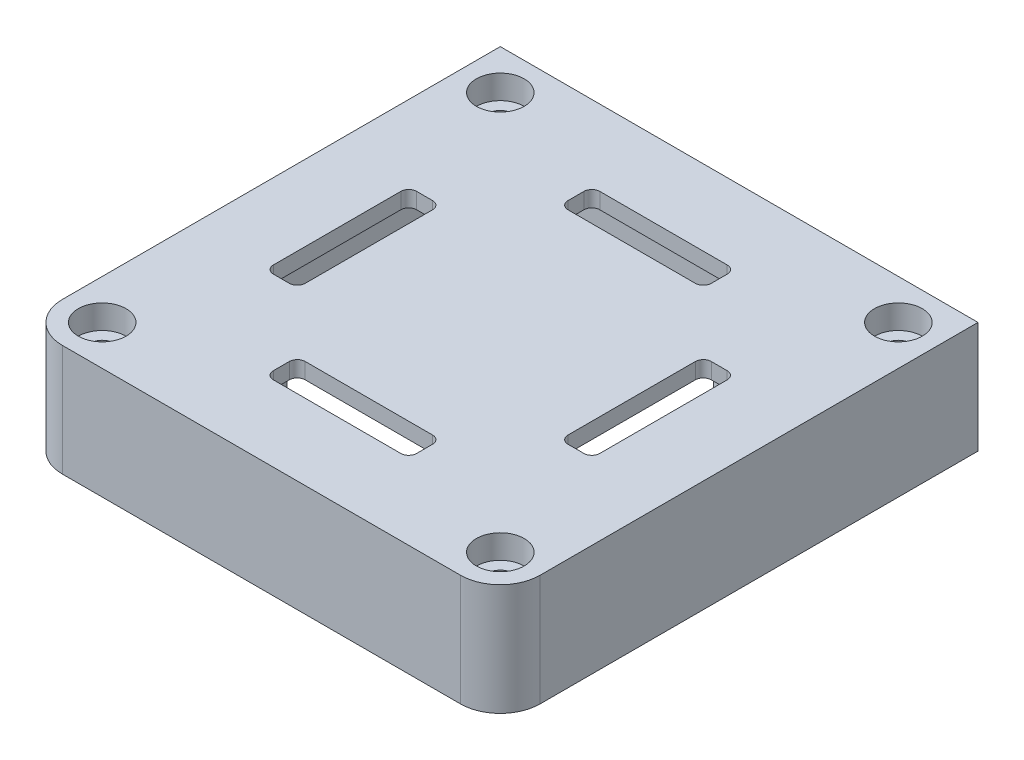
from build123d import *

# Parameters (mm, degrees)
SKETCH1_W           = 60
SKETCH1_H           = 60
BOSS_EXTRUDE1_DEPTH = 14
SKETCH2_R           = 1.5
CUT_EXTRUDE1_DEPTH  = 42
SKETCH3_R           = 3
CUT_EXTRUDE2_DEPTH  = 3
SKETCH4_W           = 45
SKETCH4_H           = 45
CUT_EXTRUDE3_DEPTH  = 12
SKETCH5_W           = 18
SKETCH5_H           = 4
SKETCH5_W_2         = 4
SKETCH5_H_2         = 18
CUT_EXTRUDE4_DEPTH  = 7
SKETCH6_R           = 2.5
BOSS_EXTRUDE2_DEPTH = 2.5
SKETCH7_R           = 1.5
CUT_EXTRUDE5_DEPTH  = 4
FILLET1_R           = 2.5
SKETCH8_R           = 3
BOSS_EXTRUDE3_DEPTH = 5
FILLET2_R           = 2.5
SKETCH9_R           = 2
CUT_EXTRUDE6_DEPTH  = 5
FILLET3_R           = 1
FILLET4_R           = 6
FILLET5_R           = 5


with BuildPart() as part:
    # Sketch1 → Boss-Extrude1 (new body)
    with BuildSketch(Plane(origin=(0, 0, 0), x_dir=(1, 0, 0), z_dir=(0, 1, 0))):
        Rectangle(SKETCH1_W, SKETCH1_H)
    extrude(amount=BOSS_EXTRUDE1_DEPTH)

    # Sketch2 → Cut-Extrude1 (cut)
    with BuildSketch(Plane(origin=(0, 14, 0), x_dir=(1, 0, 0), z_dir=(0, 1, 0))):
        with Locations(Location((-25, 25, 0), (0, 0, 270))):
            Circle(SKETCH2_R)
        with Locations(Location((-25, -25, 0), (0, 0, 270))):
            Circle(SKETCH2_R)
        with Locations(Location((25, -25, 0), (0, 0, 270))):
            Circle(SKETCH2_R)
        with Locations(Location((25, 25, 0), (0, 0, 270))):
            Circle(SKETCH2_R)
    extrude(amount=-CUT_EXTRUDE1_DEPTH, mode=Mode.SUBTRACT)

    # Sketch3 → Cut-Extrude2 (cut)
    with BuildSketch(Plane(origin=(0, 14, 0), x_dir=(1, 0, 0), z_dir=(0, 1, 0))):
        with Locations(Location((-25, 25, 0), (0, 0, 270))):
            Circle(SKETCH3_R)
        with Locations(Location((-25, -25, 0), (0, 0, 270))):
            Circle(SKETCH3_R)
        with Locations(Location((25, -25, 0), (0, 0, 270))):
            Circle(SKETCH3_R)
        with Locations(Location((25, 25, 0), (0, 0, 270))):
            Circle(SKETCH3_R)
    extrude(amount=-CUT_EXTRUDE2_DEPTH, mode=Mode.SUBTRACT)

    # Sketch4 → Cut-Extrude3 (cut)
    with BuildSketch(Plane.XZ):
        Rectangle(SKETCH4_W, SKETCH4_H)
    extrude(amount=-CUT_EXTRUDE3_DEPTH, mode=Mode.SUBTRACT)

    # Sketch5 → Cut-Extrude4 (cut)
    with BuildSketch(Plane.XZ.offset(-12)):
        with Locations((0, 18.5)):
            Rectangle(SKETCH5_W, SKETCH5_H)
        with Locations((0, -18.5)):
            Rectangle(SKETCH5_W, SKETCH5_H)
        with Locations((-18.5, 0)):
            Rectangle(SKETCH5_W_2, SKETCH5_H_2)
        with Locations((18.5, 0)):
            Rectangle(SKETCH5_W_2, SKETCH5_H_2)
    extrude(amount=-CUT_EXTRUDE4_DEPTH, mode=Mode.SUBTRACT)

    # Sketch6 → Boss-Extrude2 (add)
    with BuildSketch(Plane.XZ.offset(-12)):
        with Locations(Location((0, 6, 0), (0, 0, 270))):
            Circle(SKETCH6_R)
        with Locations(Location((0, -6, 0), (0, 0, 270))):
            Circle(SKETCH6_R)
    extrude(amount=BOSS_EXTRUDE2_DEPTH)

    # Sketch7 → Cut-Extrude5 (cut)
    with BuildSketch(Plane.XZ.offset(-9.5)):
        with Locations(Location((0, 6, 0), (0, 0, 270))):
            Circle(SKETCH7_R)
        with Locations(Location((0, -6, 0), (0, 0, 270))):
            Circle(SKETCH7_R)
    extrude(amount=-CUT_EXTRUDE5_DEPTH, mode=Mode.SUBTRACT)

    # Fillet1
    fillet1_edges = [part.edges().sort_by_distance(p)[0] for p in [
        (0, 12, 8.5),
        (0, 12, -3.5),
    ]]
    fillet(fillet1_edges, radius=FILLET1_R - 0.0001)  # a hair under: the kernel refuses the full size

    # Sketch8 → Boss-Extrude3 (add)
    with BuildSketch(Plane.XZ.offset(-12)):
        with Locations(Location((-15.5, 15.5, 0), (0, 0, 270))):
            Circle(SKETCH8_R)
        with Locations(Location((15.5, 15.5, 0), (0, 0, 270))):
            Circle(SKETCH8_R)
        with Locations(Location((15.5, -15.5, 0), (0, 0, 270))):
            Circle(SKETCH8_R)
        with Locations(Location((-15.5, -15.5, 0), (0, 0, 270))):
            Circle(SKETCH8_R)
    extrude(amount=BOSS_EXTRUDE3_DEPTH)

    # Fillet2
    fillet2_edges = [part.edges().sort_by_distance(p)[0] for p in [
        (-15.5, 12, -12.5),
        (15.5, 12, -12.5),
        (15.5, 12, 18.5),
        (-15.5, 12, 18.5),
    ]]
    fillet(fillet2_edges, radius=FILLET2_R)

    # Sketch9 → Cut-Extrude6 (cut)
    with BuildSketch(Plane.XZ.offset(-7)):
        with Locations(Location((-15.5, 15.5, 0), (0, 0, 270))):
            Circle(SKETCH9_R)
        with Locations(Location((-15.5, -15.5, 0), (0, 0, 270))):
            Circle(SKETCH9_R)
        with Locations(Location((15.5, -15.5, 0), (0, 0, 270))):
            Circle(SKETCH9_R)
        with Locations(Location((15.5, 15.5, 0), (0, 0, 270))):
            Circle(SKETCH9_R)
    extrude(amount=-CUT_EXTRUDE6_DEPTH, mode=Mode.SUBTRACT)

    # Fillet3
    fillet3_edges = [part.edges().sort_by_distance(p)[0] for p in [
        (9, 13, -16.5),
        (9, 13, -20.5),
        (-16.5, 13, 9),
        (-16.5, 13, -9),
        (-20.5, 13, -9),
        (-20.5, 13, 9),
        (20.5, 13, 9),
        (20.5, 13, -9),
        (16.5, 13, -9),
        (16.5, 13, 9),
        (-9, 13, 16.5),
        (-9, 13, 20.5),
        (9, 13, 20.5),
        (9, 13, 16.5),
        (-9, 13, -20.5),
        (-9, 13, -16.5),
    ]]
    fillet(fillet3_edges, radius=FILLET3_R)

    # Fillet4
    fillet4_edges = [part.edges().sort_by_distance(p)[0] for p in [
        (-22.5, 6, -22.5),
        (-22.5, 6, 22.5),
        (22.5, 6, 22.5),
        (22.5, 6, -22.5),
    ]]
    fillet(fillet4_edges, radius=FILLET4_R)

    # Fillet5
    fillet5_edges = [part.edges().sort_by_distance(p)[0] for p in [
        (30, 7, 30),
        (-30, 7, 30),
    ]]
    fillet(fillet5_edges, radius=FILLET5_R)


solid = part.part
